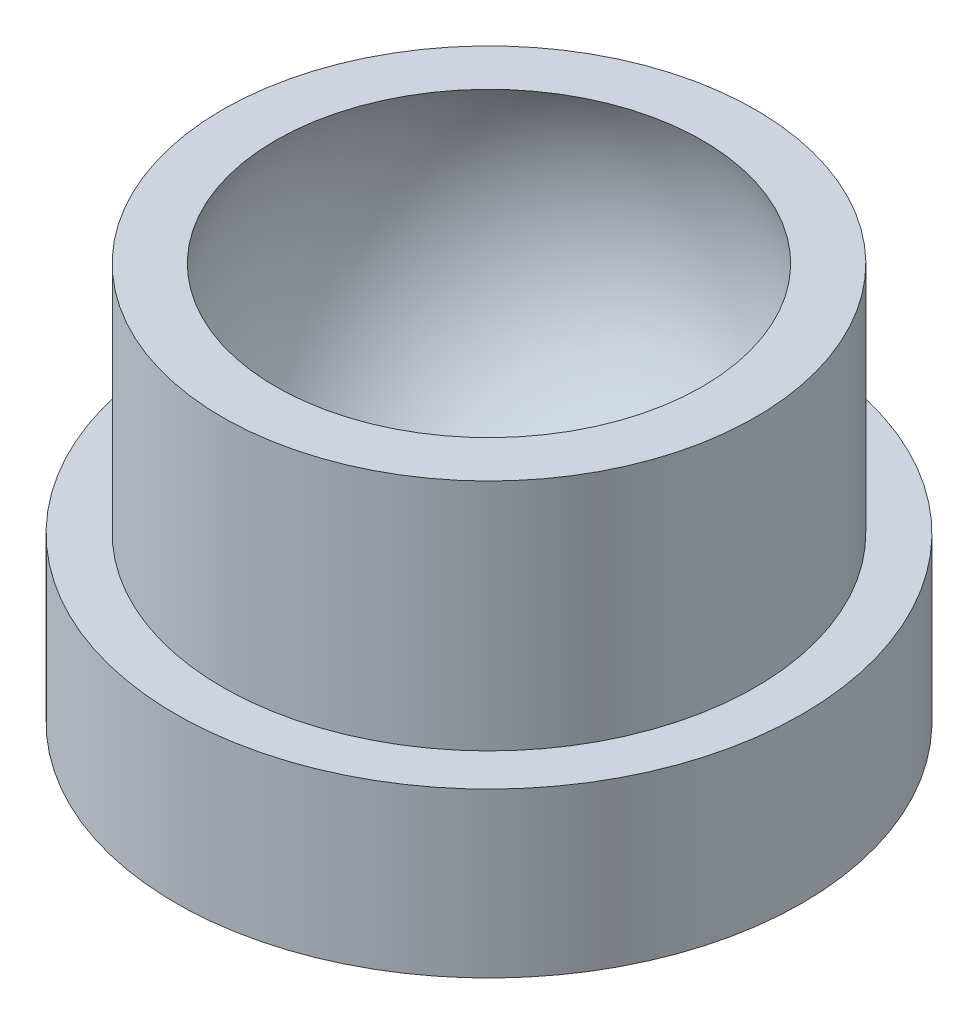
from build123d import *


with BuildPart() as part:
    # Sketch1 → Revolve1 (revolve)
    with BuildSketch(Plane.XY):
        Polygon((17.018, 12.7), (17.018, -8.89), (34.036, -8.89), (34.036, 0), (31.496, 0), (31.496, 12.7), align=None)
    revolve(axis=Axis((17.018, 12.7, 0), (0, -1, 0)))

    # Sketch2 → Cut-Revolve1 (revolve, cut)
    with BuildSketch(Plane.XY):
        with BuildLine():
            Line((4.318, 7.510807628), (29.718, 7.510807628))
            ThreePointArc((29.718, 7.510807628), (17.018, 20.210807628), (4.318, 7.510807628))
        make_face()
    revolve(axis=Axis((4.318, 7.510807628, 0), (1, 0, 0)), mode=Mode.SUBTRACT)


solid = part.part
